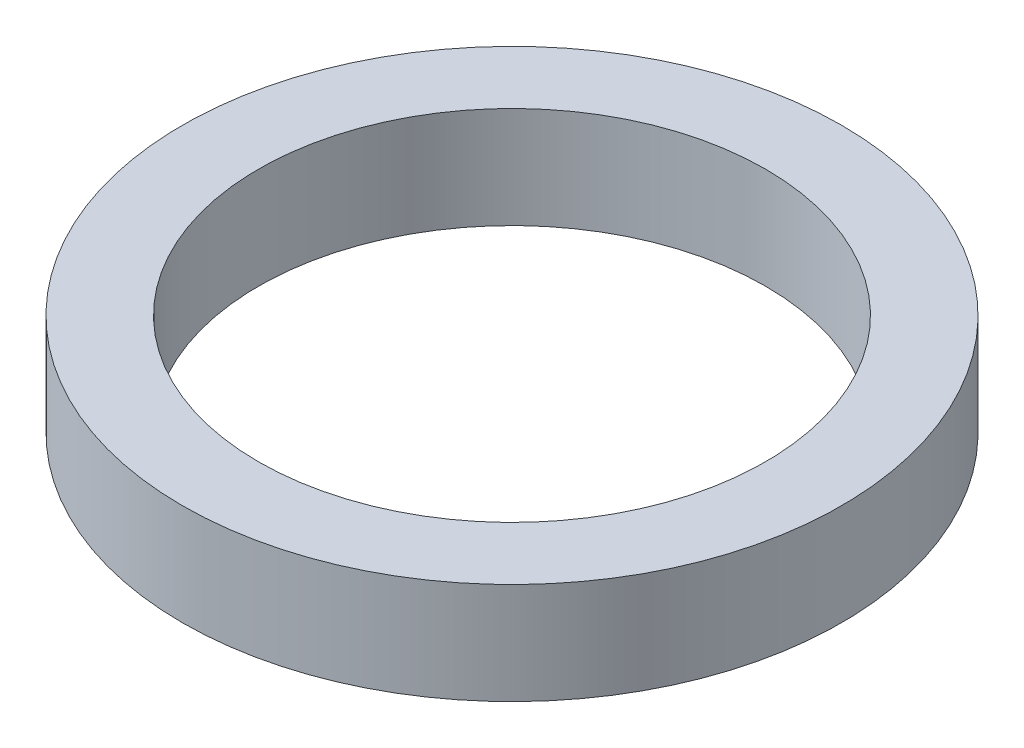
from build123d import *

# Parameters (mm, degrees)
SKETCH3_R           = 6.5
SKETCH3_R_2         = 5
BOSS_EXTRUDE3_DEPTH = 2


with BuildPart() as part:
    # Sketch3 → Boss-Extrude3 (new body)
    with BuildSketch(Plane(origin=(0, 0, 0), x_dir=(1, 0, 0), z_dir=(0, 1, 0))):
        Circle(SKETCH3_R)
        Circle(SKETCH3_R_2, mode=Mode.SUBTRACT)
    extrude(amount=BOSS_EXTRUDE3_DEPTH)


solid = part.part
